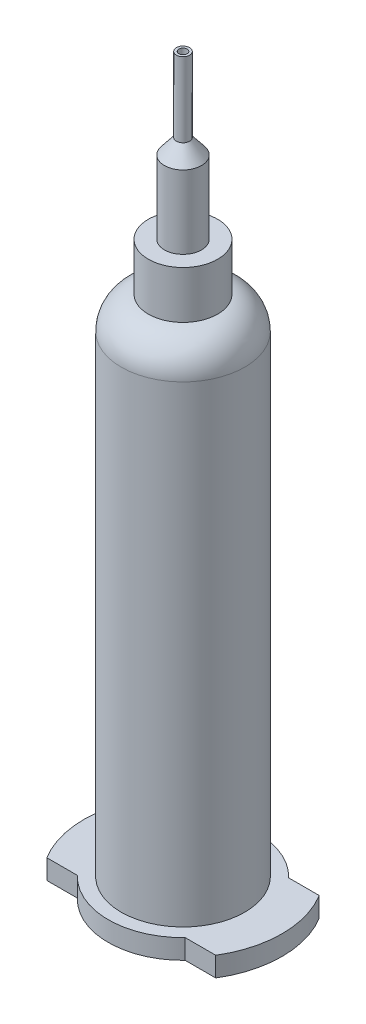
from build123d import *

# Parameters (mm, degrees)
FILLET1_R           = 5
CUT_EXTRUDE1_START  = -3
CUT_EXTRUDE1_DEPTH  = 3
SKETCH4_R           = 7.925
CUT_EXTRUDE2_DEPTH  = 74.00000000000003
SKETCH5_R           = 0.6273709550774836
CUT_EXTRUDE3_DEPTH  = 41.000000000000014
FILLET3_R           = 10
SKETCH6_R           = 7.925
BOSS_EXTRUDE2_DEPTH = 31.000000000000004


with BuildPart() as part:
    # Sketch2 → Revolve1 (revolve)
    with BuildSketch(Plane.XY, mode=Mode.PRIVATE) as revolve1_sk:
        Polygon((15.075000000000022, -55.88), (1.501e-14, -55.88), (1.501e-14, 55.88), (1.0000000000000149, 55.88), (1.0000000000000162, 44.53000000000001), (2.8250000000000046, 42.24483084777286), (2.8250000000000046, 31.120000000000005), (5.275000000000006, 31.120000000000005), (5.275000000000007, 23.880000000000006), (9.399999999999993, 23.880000000000006), (9.400000000000018, -52.88), (15.075000000000019, -52.88), align=None)
    revolve(revolve1_sk.sketch.rotate(Axis((0, 24.52235384982656, 0), (0, -1, 0)), 90), axis=Axis((0, 24.52235384982656, 0), (0, -1, 0)))

    # Fillet1
    # the kernel refuses this fillet: 5 mm, written as the material it takes off along each edge
    with BuildSketch(Plane(origin=(0, 23.880000000000006, 0), x_dir=(1.1e-16, 0, 1), z_dir=(1, 0, -1.1e-16))) as fillet1_piece_1:
        with BuildLine():
            CenterArc((4.399999999999994, 4.922842166879736), FILLET1_R, 280.07865810778594, 79.92134189221406)
            Line((9.399999999999995, 4.922842166879736), (9.499999999999995, 4.922842166879736))
            Line((9.499999999999995, 4.922842166879736), (9.499999999999993, 0))
            Line((9.499999999999993, 0), (9.399999999999993, -0.10000000000000142))
            ThreePointArc((9.399999999999993, -0.10000000000000142), (7.3374999999999195, -0.10000000000000142), (5.292499999999843, -0.09845684333667037))
            Line((5.292499999999843, -0.09845684333667037), (5.274999999999846, 9.0594e-13))
        make_face()
    revolve(axis=Axis((0, 23.880000000000006, 0), (0, -1, 0)), mode=Mode.SUBTRACT)

    # Sketch3 → Cut-Extrude1 (cut)
    with BuildSketch(Plane(origin=(0, -52.88, 0), x_dir=(1, 0, 0), z_dir=(0, 1, 0)).offset(CUT_EXTRUDE1_START)):
        with BuildLine():
            Line((-12.854571171377149, 7.875), (-8.208227579691002, 7.875))
            ThreePointArc((-8.208227579691002, 7.875), (7e-16, 11.375), (8.208227579691002, 7.875))
            Line((8.208227579691002, 7.875), (12.854571171377149, 7.875))
            ThreePointArc((12.854571171377149, 7.875), (-2.42e-15, 15.075000000000015), (-12.854571171377149, 7.875))
        make_face()
        with BuildLine():
            Line((-12.854571171377149, -7.875), (-8.208227579691002, -7.875))
            ThreePointArc((-8.208227579691002, -7.875), (7e-16, -11.375), (8.208227579691002, -7.875))
            Line((8.208227579691002, -7.875), (12.854571171377149, -7.875))
            ThreePointArc((12.854571171377149, -7.875), (-2.42e-15, -15.075000000000015), (-12.854571171377149, -7.875))
        make_face()
    extrude(amount=CUT_EXTRUDE1_DEPTH, mode=Mode.SUBTRACT)

    # Sketch4 → Cut-Extrude2 (cut)
    with BuildSketch(Plane.XZ.offset(55.88)):
        with Locations(Location((0, 0, 0), (0, 0, 270))):
            Circle(SKETCH4_R)
    extrude(amount=-CUT_EXTRUDE2_DEPTH, mode=Mode.SUBTRACT)

    # Sketch5 → Cut-Extrude3 (cut)
    with BuildSketch(Plane(origin=(0, 55.88, 0), x_dir=(1, 0, 0), z_dir=(0, 1, 0))):
        with Locations(Location((0, 0, 0), (0, 0, 270))):
            Circle(SKETCH5_R)
    extrude(amount=-CUT_EXTRUDE3_DEPTH, mode=Mode.SUBTRACT)

    # Fillet3
    # the kernel refuses this fillet: 10 mm, written as the material it takes off along each edge
    with BuildSketch(Plane(origin=(0, 18.120000000000026, 0), x_dir=(-1.8e-16, 0, 1), z_dir=(-1, 0, -1.8e-16))) as fillet3_piece_1:
        with BuildLine():
            CenterArc((10.627370955077483, 9.627938056570244), FILLET3_R, 180, 74.32162410207388)
            Line((0.6273709550774829, 9.627938056570244), (0.42737095507748285, 9.627938056570244))
            Line((0.42737095507748285, 9.627938056570244), (0.4273709550774836, 0))
            Line((0.4273709550774836, 0), (0.6273709550774836, -0.1999999999999993))
            ThreePointArc((0.6273709550774836, -0.1999999999999993), (4.276185477538742, -0.1999999999999993), (7.87095258089845, -0.19255876113140502))
            Line((7.87095258089845, -0.19255876113140502), (7.925, 0))
        make_face()
    revolve(axis=Axis((0, 18.120000000000026, 0), (0, 1, 0)), mode=Mode.SUBTRACT)


with BuildPart() as body_2:
    # Sketch6 → Boss-Extrude2 (new body)
    with BuildSketch(Plane(origin=(0, 18.120000000000015, 0), x_dir=(1, 0, 0), z_dir=(0, 1, 0))):
        with Locations(Location((0, 0, 0), (0, 0, 270))):
            Circle(SKETCH6_R)
    extrude(amount=-BOSS_EXTRUDE2_DEPTH)


solid = Compound([part.part, body_2.part])
